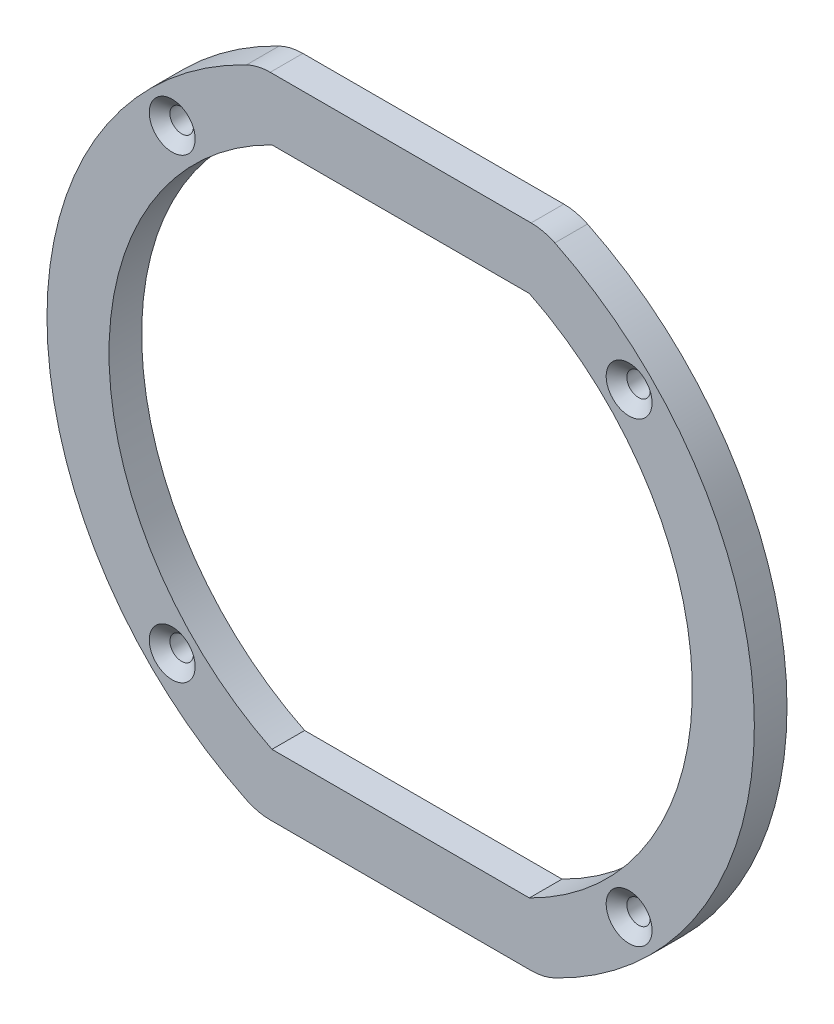
from build123d import *

# Parameters (mm, degrees)
BOSS_EXTRUDE1_DEPTH                               = 6
CSK_FOR_8_FLAT_HEAD_MACHINE_SCREW_100_D           = 4.3053
CSK_FOR_8_FLAT_HEAD_MACHINE_SCREW_100_CSINK_D     = 8.4328
CSK_FOR_8_FLAT_HEAD_MACHINE_SCREW_100_CSINK_ANGLE = 100
SKETCH5_R                                         = 1.905
BOSS_EXTRUDE2_DEPTH                               = 2.5
FILLET1_R                                         = 10


with BuildPart() as part:
    # Sketch1 → Boss-Extrude1 (new body)
    with BuildSketch(Plane.XY):
        with BuildLine():
            Line((-26.167728216, 59.5), (26.167728216, 59.5))
            ThreePointArc((26.167728216, 59.5), (65, 0), (26.167728216, -59.5))
            Line((26.167728216, -59.5), (-26.167728216, -59.5))
            ThreePointArc((-26.167728216, -59.5), (-65, 0), (-26.167728216, 59.5))
        make_face()
        with BuildLine():
            Line((-23.650581388, 48.1), (23.650581388, 48.1))
            ThreePointArc((23.650581388, 48.1), (53.6, 0), (23.650581388, -48.1))
            Line((23.650581388, -48.1), (-23.650581388, -48.1))
            ThreePointArc((-23.650581388, -48.1), (-53.6, 0), (-23.650581388, 48.1))
        make_face(mode=Mode.SUBTRACT)
    extrude(amount=BOSS_EXTRUDE1_DEPTH)

    # CSK for #8 Flat Head Machine Screw (100)1 (through all)
    with Locations(Plane.XY.offset(6)):
        with Locations((0, 0), (41.985, 41.985), (-41.985, -41.985), (-41.985, 41.985), (41.985, -41.985)):
            CounterSinkHole(CSK_FOR_8_FLAT_HEAD_MACHINE_SCREW_100_D / 2, CSK_FOR_8_FLAT_HEAD_MACHINE_SCREW_100_CSINK_D / 2, counter_sink_angle=CSK_FOR_8_FLAT_HEAD_MACHINE_SCREW_100_CSINK_ANGLE)

    # Sketch5 → Boss-Extrude2 (add)
    with BuildSketch(Plane(origin=(0, 0, 0), x_dir=(-1, 0, 0), z_dir=(0, 0, -1))):
        with Locations((-59.2455, 0)):
            Circle(SKETCH5_R)
        with Locations((59.2455, 0)):
            Circle(SKETCH5_R)
    extrude(amount=BOSS_EXTRUDE2_DEPTH)

    # Fillet1
    fillet1_edges = [part.edges().sort_by_distance(p)[0] for p in [
        (26.167728216, -59.5, 3),
        (-26.167728216, -59.5, 3),
        (26.167728216, 59.5, 3),
        (-26.167728216, 59.5, 3),
    ]]
    fillet(fillet1_edges, radius=FILLET1_R)


solid = part.part
